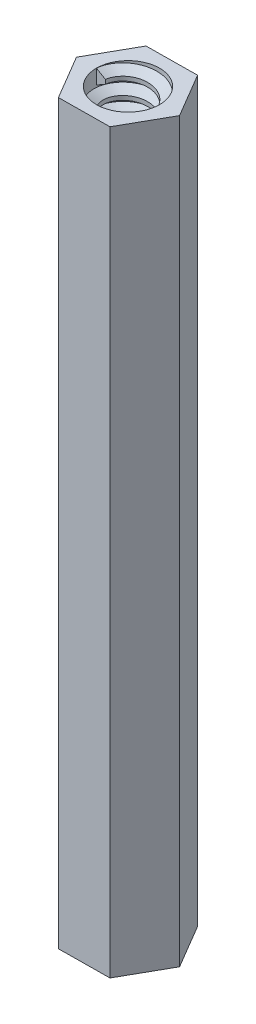
from build123d import *
from build123d.topology import SkipClean

# Parameters (mm, degrees)
EXTRUDE_1_DEPTH     = 35
SKETCH_2_R          = 1.5
CUT_EXTRUDE_1_DEPTH = 5
THREAD_1_PITCH      = 0.79375
CUT_EXTRUDE_START   = -7
SKETCH_7_R          = 1.5
CUT_EXTRUDE_2_DEPTH = 7
THREAD_2_PITCH      = 0.79375


with BuildPart() as part:
    # Sketch 1 → 凸台-拉伸1 (new body)
    with BuildSketch(Plane(origin=(0, 0, 0), x_dir=(1, 0, 0), z_dir=(0, 1, 0))):
        Polygon((-1.232932986, 2.088031669), (-2.424754963, -0.023735452), (-1.191821977, -2.111767122), (1.232932986, -2.088031669), (2.424754963, 0.023735452), (1.191821977, 2.111767122), align=None)
    extrude(amount=EXTRUDE_1_DEPTH)

    # Sketch 2 → 切除-拉伸1 (cut)
    with BuildSketch(Plane(origin=(0, 35, 0), x_dir=(1, 0, 0), z_dir=(0, 1, 0))):
        with Locations(Location((0, 0, 0), (0, 0, 270))):
            Circle(SKETCH_2_R)
    extrude(amount=-CUT_EXTRUDE_1_DEPTH, mode=Mode.SUBTRACT)

    # 螺纹线1: the profile of Sketch 1 2 profile screwed along a right-hand helix of 6.299213 turns, 8 arcs to a turn; built about Z, then put on its axis
    with SkipClean():  # the faces are left unmerged after this step: merging them gives an invalid solid
        thread_1_z = Axis((0, 0, 0), (0, 0, 1))
        thread_1_corners = [(1.5003, 0, -0.000173205), (1.5003, 0, 0.694704453), (1.070370212, 0, 0.446484374), (1.070370212, 0, 0.248046874)]
        with BuildLine(mode=Mode.PRIVATE) as thread_1_profile:
            Line(thread_1_corners[0], thread_1_corners[1])
            Line(thread_1_corners[1], thread_1_corners[2])
            Line(thread_1_corners[2], thread_1_corners[3])
            Line(thread_1_corners[3], thread_1_corners[0])
        thread_1_cap = Face(thread_1_profile.wire())
        thread_1_turn_angles = [0, 22.5, 45, 67.5, 90, 112.5, 135, 157.5, 180, 202.5, 225, 247.5, 270, 292.5, 315, 337.5, 360]
        thread_1_turn_weights = [1, 0.9238795325112867, 1, 0.9238795325112867, 1, 0.9238795325112867, 1, 0.9238795325112867, 1, 0.9238795325112867, 1, 0.9238795325112867, 1, 0.9238795325112867, 1, 0.9238795325112867, 1]
        thread_1_turn_rails = [Edge.make_bspline([Vector(p[0], p[1], 0).rotate(thread_1_z, thread_1_turn_angles[k]) / thread_1_turn_weights[k] + Vector(0, 0, p[2] + THREAD_1_PITCH * thread_1_turn_angles[k] / 360) for k in range(17)], [0, 0, 0, 1, 1, 2, 2, 3, 3, 4, 4, 5, 5, 6, 6, 7, 7, 8, 8, 8], 2, thread_1_turn_weights) for p in thread_1_corners]
        thread_1_turn_sides = [Face.make_surface_from_curves(thread_1_turn_rails[p[0]], thread_1_turn_rails[p[1]]) for p in [(0, 1), (1, 2), (2, 3), (3, 0)]]
        thread_1_last_angles = [2160, 2182.5, 2205, 2227.5, 2250, 2258.858267717, 2267.716535433]
        thread_1_last_weights = [1, 0.9238795325112867, 1, 0.9238795325112867, 1, 0.988072289441528, 1]
        thread_1_last_rails = [Edge.make_bspline([Vector(p[0], p[1], 0).rotate(thread_1_z, thread_1_last_angles[k]) / thread_1_last_weights[k] + Vector(0, 0, p[2] + THREAD_1_PITCH * thread_1_last_angles[k] / 360) for k in range(7)], [0, 0, 0, 1, 1, 2, 2, 3, 3, 3], 2, thread_1_last_weights) for p in thread_1_corners]
        thread_1_last_sides = [Face.make_surface_from_curves(thread_1_last_rails[p[0]], thread_1_last_rails[p[1]]) for p in [(0, 1), (1, 2), (2, 3), (3, 0)]]
        thread_1 = Plane(origin=(0, 35, 0), x_dir=(-1, 0, 0), z_dir=(0, -1, 0)) * Solid(Shell([*[p.moved(Location((0, 0, THREAD_1_PITCH * i))) for i in range(6) for p in thread_1_turn_sides], *thread_1_last_sides, thread_1_cap, thread_1_cap.rotate(thread_1_z, 2267.716535433).moved(Location((0, 0, THREAD_1_PITCH * 2267.716535433 / 360)))]))
        add(thread_1)

    # 草图7 → 切除-拉伸2 (cut)
    with SkipClean():  # the faces are left unmerged after this step: merging them gives an invalid solid
        with BuildSketch(Plane.XZ.offset(CUT_EXTRUDE_START)):
            with Locations(Location((0, 0, 0), (0, 0, 270))):
                Circle(SKETCH_7_R)
        extrude(amount=CUT_EXTRUDE_2_DEPTH, mode=Mode.SUBTRACT)

    # 螺纹线2: the profile of Sketch 2 2 profile screwed along a right-hand helix of 8.818898 turns, 8 arcs to a turn; built about Z, then put on its axis
    with SkipClean():  # the faces are left unmerged after this step: merging them gives an invalid solid
        thread_2_z = Axis((0, 0, 0), (0, 0, 1))
        thread_2_corners = [(1.5003, 0, -0.000173205), (1.5003, 0, 0.694704453), (1.070370212, 0, 0.446484374), (1.070370212, 0, 0.248046874)]
        with BuildLine(mode=Mode.PRIVATE) as thread_2_profile:
            Line(thread_2_corners[0], thread_2_corners[1])
            Line(thread_2_corners[1], thread_2_corners[2])
            Line(thread_2_corners[2], thread_2_corners[3])
            Line(thread_2_corners[3], thread_2_corners[0])
        thread_2_cap = Face(thread_2_profile.wire())
        thread_2_turn_angles = [0, 22.5, 45, 67.5, 90, 112.5, 135, 157.5, 180, 202.5, 225, 247.5, 270, 292.5, 315, 337.5, 360]
        thread_2_turn_weights = [1, 0.9238795325112867, 1, 0.9238795325112867, 1, 0.9238795325112867, 1, 0.9238795325112867, 1, 0.9238795325112867, 1, 0.9238795325112867, 1, 0.9238795325112867, 1, 0.9238795325112867, 1]
        thread_2_turn_rails = [Edge.make_bspline([Vector(p[0], p[1], 0).rotate(thread_2_z, thread_2_turn_angles[k]) / thread_2_turn_weights[k] + Vector(0, 0, p[2] + THREAD_2_PITCH * thread_2_turn_angles[k] / 360) for k in range(17)], [0, 0, 0, 1, 1, 2, 2, 3, 3, 4, 4, 5, 5, 6, 6, 7, 7, 8, 8, 8], 2, thread_2_turn_weights) for p in thread_2_corners]
        thread_2_turn_sides = [Face.make_surface_from_curves(thread_2_turn_rails[p[0]], thread_2_turn_rails[p[1]]) for p in [(0, 1), (1, 2), (2, 3), (3, 0)]]
        thread_2_last_angles = [2880, 2902.5, 2925, 2947.5, 2970, 2992.5, 3015, 3037.5, 3060, 3082.5, 3105, 3127.5, 3150, 3162.401574803, 3174.803149606]
        thread_2_last_weights = [1, 0.9238795325112867, 1, 0.9238795325112867, 1, 0.9238795325112867, 1, 0.9238795325112867, 1, 0.9238795325112867, 1, 0.9238795325112867, 1, 0.9766663758574117, 1]
        thread_2_last_rails = [Edge.make_bspline([Vector(p[0], p[1], 0).rotate(thread_2_z, thread_2_last_angles[k]) / thread_2_last_weights[k] + Vector(0, 0, p[2] + THREAD_2_PITCH * thread_2_last_angles[k] / 360) for k in range(15)], [0, 0, 0, 1, 1, 2, 2, 3, 3, 4, 4, 5, 5, 6, 6, 7, 7, 7], 2, thread_2_last_weights) for p in thread_2_corners]
        thread_2_last_sides = [Face.make_surface_from_curves(thread_2_last_rails[p[0]], thread_2_last_rails[p[1]]) for p in [(0, 1), (1, 2), (2, 3), (3, 0)]]
        thread_2 = Plane(origin=(0, 0, 0), x_dir=(1, 0, 0), z_dir=(0, 1, 0)) * Solid(Shell([*[p.moved(Location((0, 0, THREAD_2_PITCH * i))) for i in range(8) for p in thread_2_turn_sides], *thread_2_last_sides, thread_2_cap, thread_2_cap.rotate(thread_2_z, 3174.803149606).moved(Location((0, 0, THREAD_2_PITCH * 3174.803149606 / 360)))]))
        add(thread_2)


solid = part.part
